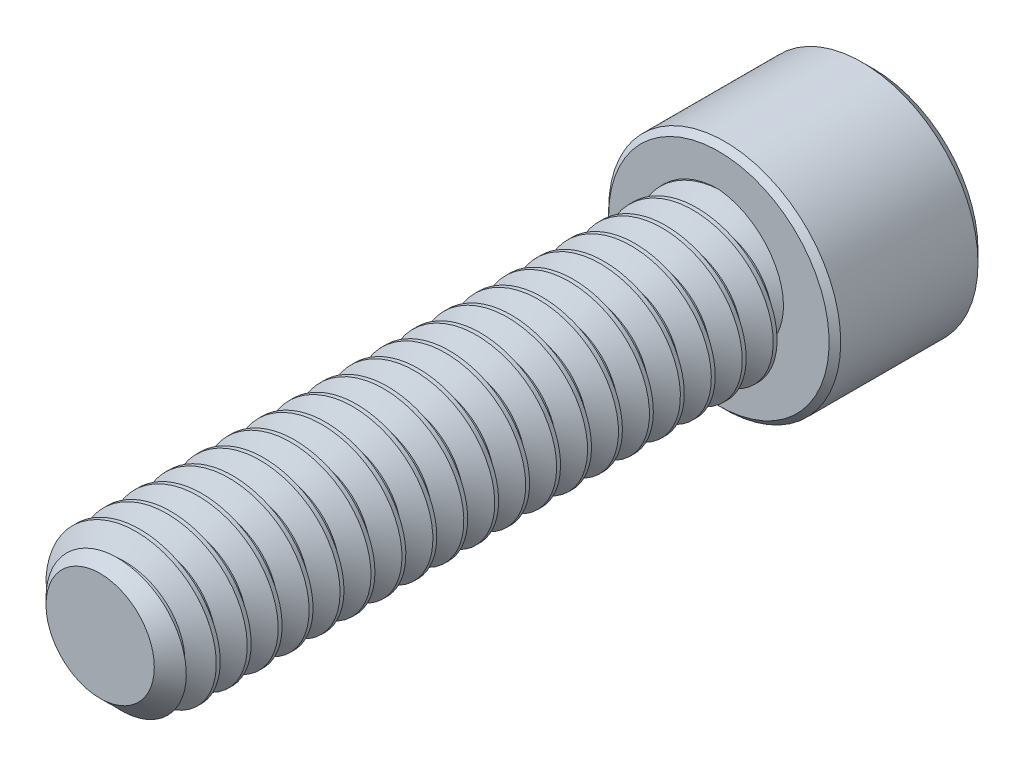
from build123d import *

# Parameters (mm, degrees)
SKETCH1_R          = 3.175
EXTRUDE1_DEPTH     = 25.4
CHAMFER3_SIZE      = 0.9525
CUT_SWEEP1_PITCH   = 1.27
SKETCH6_R          = 4.7625
EXTRUDE2_DEPTH     = 6.35
CUT_EXTRUDE1_DEPTH = 3.571875
CHAMFER1_SIZE      = 0.47625
CHAMFER2_SIZE      = 0.238125


with BuildPart() as part:
    # Sketch1 → Extrude1 (new body)
    with BuildSketch(Plane.XY):
        Circle(SKETCH1_R)
    extrude(amount=-EXTRUDE1_DEPTH)

    # Chamfer3
    chamfer3_edges = [part.edges().sort_by_distance(p)[0] for p in [
        (-3.175, 0, 0),
    ]]
    chamfer(chamfer3_edges, length=CHAMFER3_SIZE)

    # Cut-Sweep1: the profile of Sketch3 profile screwed along a right-hand helix of 21 turns, 6 arcs to a turn; built about Z, then put on its axis
    cut_sweep1_z = Axis((0, 0, 0), (0, 0, 1))
    cut_sweep1_corners = [(3.1753, 0, -1.111423205), (2.350110803, 0, -0.635), (2.350110803, 0, -0.47625), (3.1753, 0, 0.000173205)]
    with BuildLine(mode=Mode.PRIVATE) as cut_sweep1_profile:
        Line(cut_sweep1_corners[0], cut_sweep1_corners[1])
        Line(cut_sweep1_corners[1], cut_sweep1_corners[2])
        Line(cut_sweep1_corners[2], cut_sweep1_corners[3])
        Line(cut_sweep1_corners[3], cut_sweep1_corners[0])
    cut_sweep1_cap = Face(cut_sweep1_profile.wire())
    cut_sweep1_turn_angles = [0, 30, 60, 90, 120, 150, 180, 210, 240, 270, 300, 330, 360]
    cut_sweep1_turn_weights = [1, 0.8660254037844387, 1, 0.8660254037844387, 1, 0.8660254037844387, 1, 0.8660254037844387, 1, 0.8660254037844387, 1, 0.8660254037844387, 1]
    cut_sweep1_turn_rails = [Edge.make_bspline([Vector(p[0], p[1], 0).rotate(cut_sweep1_z, cut_sweep1_turn_angles[k]) / cut_sweep1_turn_weights[k] + Vector(0, 0, p[2] + CUT_SWEEP1_PITCH * cut_sweep1_turn_angles[k] / 360) for k in range(13)], [0, 0, 0, 1, 1, 2, 2, 3, 3, 4, 4, 5, 5, 6, 6, 6], 2, cut_sweep1_turn_weights) for p in cut_sweep1_corners]
    cut_sweep1_turn_sides = [Face.make_surface_from_curves(cut_sweep1_turn_rails[p[0]], cut_sweep1_turn_rails[p[1]]) for p in [(0, 1), (1, 2), (2, 3), (3, 0)]]
    cut_sweep1 = Plane(origin=(0, 0, 0), x_dir=(0, 1, 0), z_dir=(0, 0, -1)) * Solid(Shell([*[p.moved(Location((0, 0, CUT_SWEEP1_PITCH * i))) for i in range(21) for p in cut_sweep1_turn_sides], cut_sweep1_cap, cut_sweep1_cap.rotate(cut_sweep1_z, 7560).moved(Location((0, 0, CUT_SWEEP1_PITCH * 7560 / 360)))]))
    add(cut_sweep1, mode=Mode.SUBTRACT)

    # Sketch6 → Extrude2 (add)
    with BuildSketch(Plane(origin=(0, 0, -25.4), x_dir=(-1, 0, 0), z_dir=(0, 0, -1))):
        Circle(SKETCH6_R)
    extrude(amount=EXTRUDE2_DEPTH)

    # Sketch7 → Cut-Extrude1 (cut)
    with BuildSketch(Plane(origin=(0, 0, -31.75), x_dir=(-1, 0, 0), z_dir=(0, 0, -1))):
        Polygon((0, 2.749630657), (-2.38125, 1.374815329), (-2.38125, -1.374815329), (0, -2.749630657), (2.38125, -1.374815329), (2.38125, 1.374815329), align=None)
    extrude(amount=-CUT_EXTRUDE1_DEPTH, mode=Mode.SUBTRACT)

    # Cut-Extrude2 cone 1 section (through the dimple's axis) → Cut-Extrude2 (revolve, cut)
    with BuildSketch(Plane(origin=(0, 0, -31.75), x_dir=(0, 1, 0), z_dir=(1, 0, 0))):
        Polygon((0, 0), (2.749630657, 0), (0, 2.749630657), align=None)
    revolve(axis=Axis((0, 0, -31.75), (0, 0, 1)), mode=Mode.SUBTRACT)

    # Chamfer1
    chamfer1_edges = [part.edges().sort_by_distance(p)[0] for p in [
        (4.7625, 0, -31.75),
    ]]
    chamfer(chamfer1_edges, length=CHAMFER1_SIZE)

    # Chamfer2
    chamfer2_edges = [part.edges().sort_by_distance(p)[0] for p in [
        (4.7625, 0, -25.4),
    ]]
    chamfer(chamfer2_edges, length=CHAMFER2_SIZE)


solid = part.part
